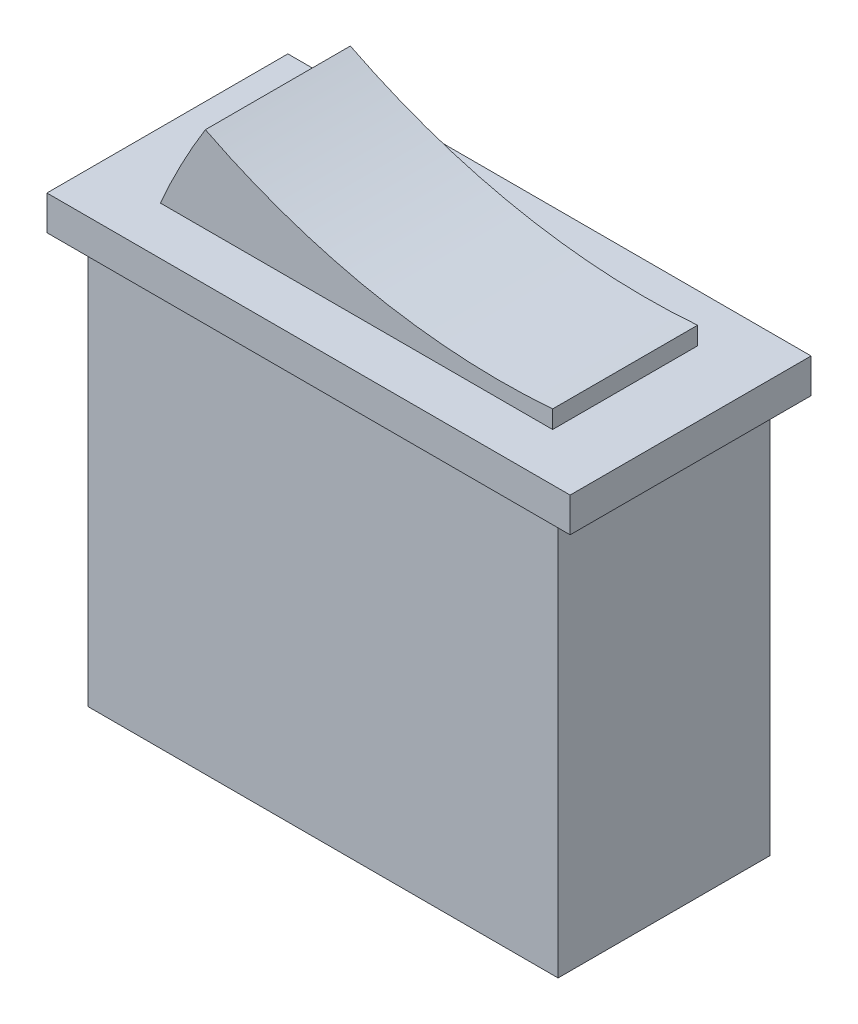
from build123d import *

# Parameters (mm, degrees)
SKETCH1_W           = 27.3
SKETCH1_H           = 12.3
BOSS_EXTRUDE1_DEPTH = 23.5
SKETCH3_W           = 30.4
SKETCH3_H           = 14
BOSS_EXTRUDE2_DEPTH = 2
SKETCH4_W           = 22.788352984
SKETCH4_H           = 8.421389372
BOSS_EXTRUDE3_DEPTH = 5
CUT_EXTRUDE2_START  = -8.421389371
CUT_EXTRUDE2_DEPTH  = 8.421389371


# Read off the part's stored shape, not the designer's step: Cut-Extrude2
with BuildPart() as part:
    # Sketch1 → Boss-Extrude1 (new body)
    with BuildSketch(Plane(origin=(0, 0, 0), x_dir=(1, 0, 0), z_dir=(0, 1, 0))):
        Rectangle(SKETCH1_W, SKETCH1_H)
    extrude(amount=BOSS_EXTRUDE1_DEPTH)

    # Sketch3 → Boss-Extrude2 (add)
    with BuildSketch(Plane(origin=(0, 23.5, 0), x_dir=(1, 0, 0), z_dir=(0, 1, 0))):
        Rectangle(SKETCH3_W, SKETCH3_H)
    extrude(amount=BOSS_EXTRUDE2_DEPTH)

    # Sketch4 → Boss-Extrude3 (add)
    with BuildSketch(Plane(origin=(0, 25.5, 0), x_dir=(1, 0, 0), z_dir=(0, 1, 0))):
        Rectangle(SKETCH4_W, SKETCH4_H)
    extrude(amount=BOSS_EXTRUDE3_DEPTH)

    # Cut-Extrude2 outline → Cut-Extrude2 (cut)
    with BuildSketch(Plane.XY.offset(4.210694686).offset(CUT_EXTRUDE2_START)):
        with BuildLine():
            ThreePointArc((-11.394176492, 25.5), (-10.180313992, 28.04843269), (-8.781103834, 30.5))
            Line((-8.781103834, 30.5), (-11.394176492, 30.5))
            Line((-11.394176492, 30.5), (-11.394176492, 25.5))
        make_face()
        with BuildLine():
            ThreePointArc((-8.781103834, 30.5), (1.034220457, 27.1323045), (11.394176492, 26.537935189))
            Line((11.394176492, 26.537935189), (11.394176492, 30.5))
            Line((11.394176492, 30.5), (-8.781103834, 30.5))
        make_face()
    extrude(amount=CUT_EXTRUDE2_DEPTH, mode=Mode.SUBTRACT)


solid = part.part
